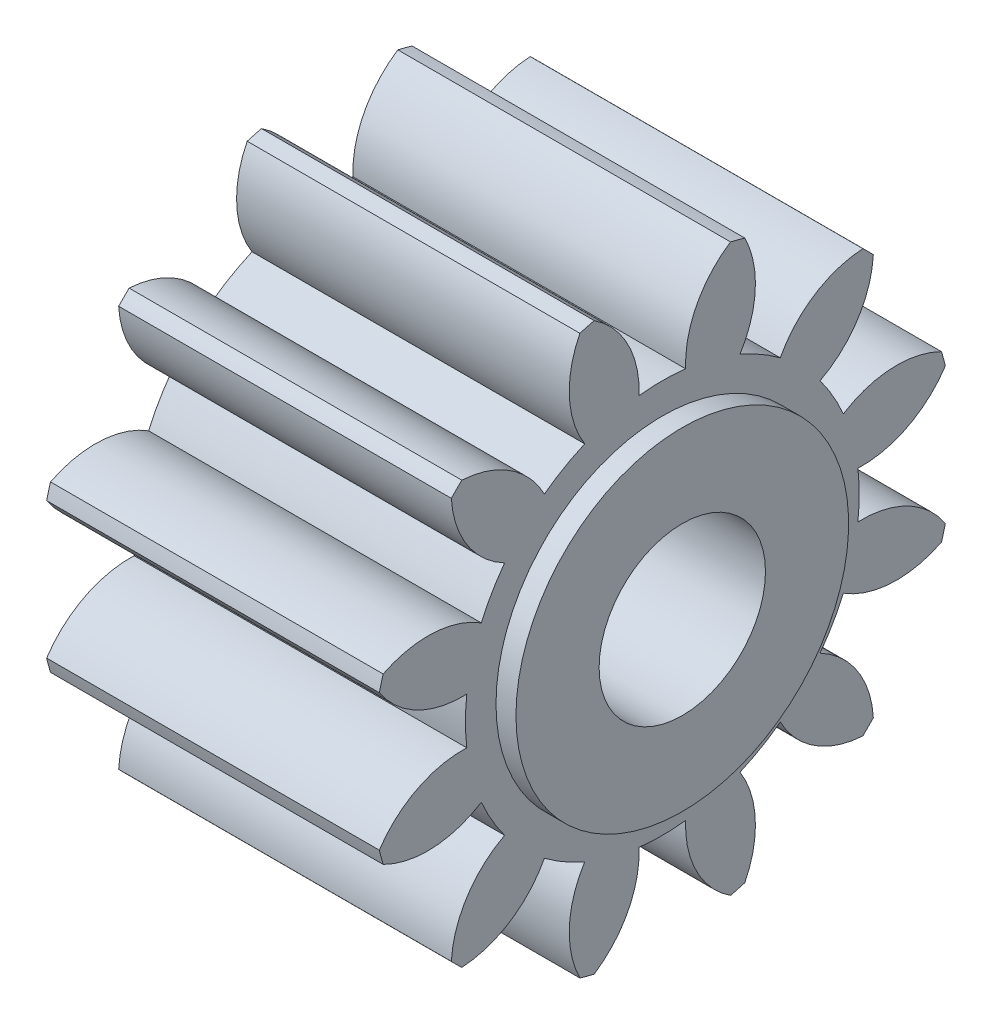
from build123d import *

# Parameters (mm, degrees)
SPUR_START             = -44.404191422
SPUR_GEAR_AI_OUTLINE_R = 1.5875
SPUR_GEAR_AI_DEPTH     = 6.35
SKETCH1_R              = 3.175
SKETCH1_R_2            = 1.5875
BOSS_EXTRUDE1_DEPTH    = 0.381
BOSS_EXTRUDE2_START    = 0.381
SKETCH2_R              = 3.175
SKETCH2_R_2            = 1.5875
BOSS_EXTRUDE2_DEPTH    = 0.381


# Read off the part's stored shape, not the designer's step: spur gear_ai
with BuildPart() as part:
    # spur gear_ai outline → spur gear_ai (new body)
    with BuildSketch(Plane.YZ.offset(SPUR_START)):
        with BuildLine():
            ThreePointArc((11.6994841, 14.055943365), (11.800698547, 14.154615032), (11.899370214, 14.255829479))
            ThreePointArc((11.899370214, 14.255829479), (11.59841749, 15.177920223), (10.882448174, 15.832299182))
            ThreePointArc((10.882448174, 15.832299182), (11.127399192, 16.203877085), (11.326719587, 16.601799841))
            ThreePointArc((11.326719587, 16.601799841), (12.251413047, 16.308941704), (13.200443418, 16.509354372))
            ThreePointArc((13.200443418, 16.509354372), (13.238761866, 16.645413766), (13.273606813, 16.782403881))
            ThreePointArc((13.273606813, 16.782403881), (12.551928737, 17.430481528), (11.604691642, 17.639205672))
            ThreePointArc((11.604691642, 17.639205672), (11.631036494, 18.083477085), (11.604691642, 18.527748498))
            ThreePointArc((11.604691642, 18.527748498), (12.551928737, 18.736472642), (13.273606813, 19.384550289))
            ThreePointArc((13.273606813, 19.384550289), (13.238761866, 19.521540404), (13.200443418, 19.657599798))
            ThreePointArc((13.200443418, 19.657599798), (12.251413047, 19.858012466), (11.326719587, 19.565154329))
            ThreePointArc((11.326719587, 19.565154329), (11.127399192, 19.963077085), (10.882448174, 20.334654988))
            ThreePointArc((10.882448174, 20.334654988), (11.59841749, 20.989033947), (11.899370214, 21.911124691))
            ThreePointArc((11.899370214, 21.911124691), (11.800698547, 22.012339138), (11.6994841, 22.111010805))
            ThreePointArc((11.6994841, 22.111010805), (10.777393356, 21.810058081), (10.123014397, 21.094088765))
            ThreePointArc((10.123014397, 21.094088765), (9.751436494, 21.339039783), (9.353513738, 21.538360178))
            ThreePointArc((9.353513738, 21.538360178), (9.646371875, 22.463053638), (9.445959207, 23.412084009))
            ThreePointArc((9.445959207, 23.412084009), (9.309899813, 23.450402457), (9.172909698, 23.485247404))
            ThreePointArc((9.172909698, 23.485247404), (8.524832051, 22.763569327), (8.316107907, 21.816332232))
            ThreePointArc((8.316107907, 21.816332232), (7.871836494, 21.842677085), (7.427565081, 21.816332232))
            ThreePointArc((7.427565081, 21.816332232), (7.218840938, 22.763569328), (6.57076329, 23.485247404))
            ThreePointArc((6.57076329, 23.485247404), (6.433773175, 23.450402457), (6.297713781, 23.412084009))
            ThreePointArc((6.297713781, 23.412084009), (6.097301113, 22.463053638), (6.39015925, 21.538360178))
            ThreePointArc((6.39015925, 21.538360178), (5.992236494, 21.339039783), (5.620658591, 21.094088765))
            ThreePointArc((5.620658591, 21.094088765), (4.966279632, 21.810058081), (4.044188888, 22.111010805))
            ThreePointArc((4.044188888, 22.111010805), (3.942974441, 22.012339138), (3.844302774, 21.911124691))
            ThreePointArc((3.844302774, 21.911124691), (4.145255498, 20.989033947), (4.861224814, 20.334654988))
            ThreePointArc((4.861224814, 20.334654988), (4.616273796, 19.963077085), (4.416953401, 19.565154329))
            ThreePointArc((4.416953401, 19.565154329), (3.492259941, 19.858012466), (2.54322957, 19.657599798))
            ThreePointArc((2.54322957, 19.657599798), (2.504911122, 19.521540404), (2.470066175, 19.384550289))
            ThreePointArc((2.470066175, 19.384550289), (3.191744252, 18.736472642), (4.138981347, 18.527748498))
            ThreePointArc((4.138981347, 18.527748498), (4.112636494, 18.083477085), (4.138981347, 17.639205672))
            ThreePointArc((4.138981347, 17.639205672), (3.191744252, 17.430481528), (2.470066175, 16.782403881))
            ThreePointArc((2.470066175, 16.782403881), (2.504911122, 16.645413766), (2.54322957, 16.509354372))
            ThreePointArc((2.54322957, 16.509354372), (3.492259941, 16.308941704), (4.416953401, 16.601799841))
            ThreePointArc((4.416953401, 16.601799841), (4.616273796, 16.203877085), (4.861224814, 15.832299182))
            ThreePointArc((4.861224814, 15.832299182), (4.145255498, 15.177920223), (3.844302774, 14.255829479))
            ThreePointArc((3.844302774, 14.255829479), (3.942974441, 14.154615032), (4.044188888, 14.055943365))
            ThreePointArc((4.044188888, 14.055943365), (4.966279632, 14.356896089), (5.620658591, 15.072865405))
            ThreePointArc((5.620658591, 15.072865405), (5.992236494, 14.827914387), (6.39015925, 14.628593992))
            ThreePointArc((6.39015925, 14.628593992), (6.097301113, 13.703900532), (6.297713781, 12.754870161))
            ThreePointArc((6.297713781, 12.754870161), (6.433773175, 12.716551713), (6.57076329, 12.681706766))
            ThreePointArc((6.57076329, 12.681706766), (7.218840938, 13.403384842), (7.427565081, 14.350621938))
            ThreePointArc((7.427565081, 14.350621938), (7.871836494, 14.324277085), (8.316107907, 14.350621938))
            ThreePointArc((8.316107907, 14.350621938), (8.524832051, 13.403384843), (9.172909698, 12.681706766))
            ThreePointArc((9.172909698, 12.681706766), (9.309899813, 12.716551713), (9.445959207, 12.754870161))
            ThreePointArc((9.445959207, 12.754870161), (9.646371875, 13.703900532), (9.353513738, 14.628593992))
            ThreePointArc((9.353513738, 14.628593992), (9.751436494, 14.827914387), (10.123014397, 15.072865405))
            ThreePointArc((10.123014397, 15.072865405), (10.777393356, 14.356896089), (11.6994841, 14.055943365))
        make_face()
        with Locations((7.871836494, 18.083477085)):
            Circle(SPUR_GEAR_AI_OUTLINE_R, mode=Mode.SUBTRACT)
    extrude(amount=SPUR_GEAR_AI_DEPTH)

    # Sketch1 → Boss-Extrude1 (add)
    with BuildSketch(Plane(origin=(-38.054191422, 0, 0), x_dir=(0, 0, -1), z_dir=(1, 0, 0))):
        with Locations(Location((-18.083477085, 7.871836494, 0), (0, 0, 180))):
            Circle(SKETCH1_R)
        with Locations((-18.083477085, 7.871836494)):
            Circle(SKETCH1_R_2, mode=Mode.SUBTRACT)
    extrude(amount=BOSS_EXTRUDE1_DEPTH)

    # Sketch2 → Boss-Extrude2 (add)
    with BuildSketch(Plane.ZY.offset(44.404191422).offset(BOSS_EXTRUDE2_START)):
        with Locations((18.083477085, 7.871836494)):
            Circle(SKETCH2_R)
        with Locations((18.083477085, 7.871836494)):
            Circle(SKETCH2_R_2, mode=Mode.SUBTRACT)
    extrude(amount=-BOSS_EXTRUDE2_DEPTH)


solid = part.part
